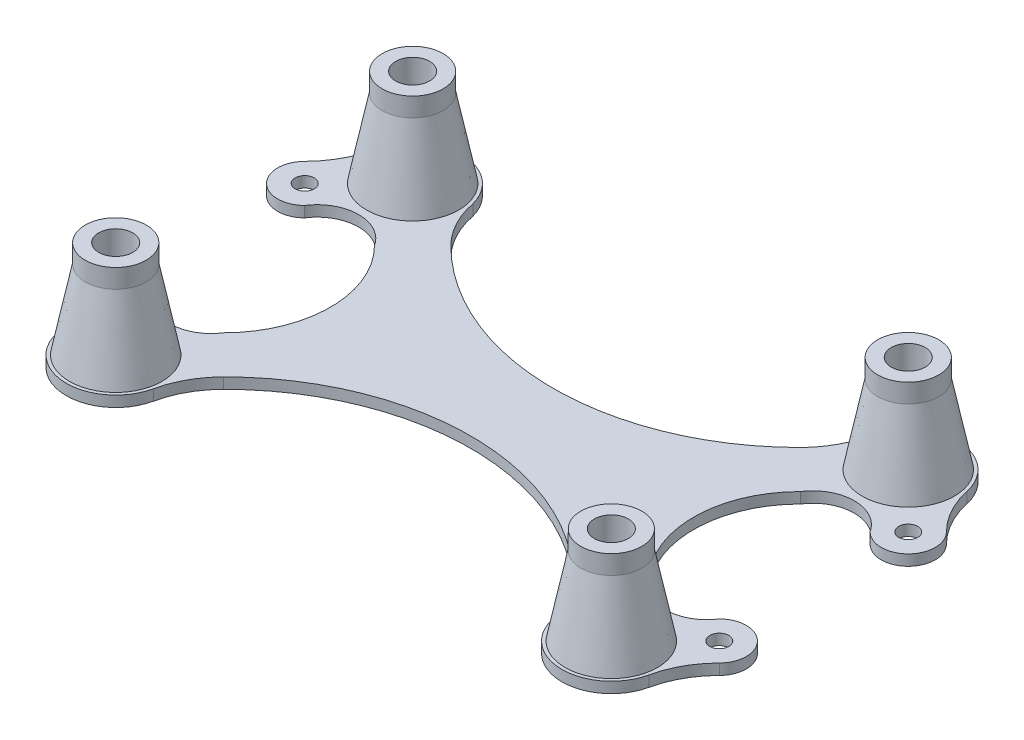
from build123d import *

# Parameters (mm, degrees)
BOSS_EXTRUDE1_DEPTH   = 2.54
SKETCH1_4_R           = 7.175
SKETCH1_4_R_2         = 4
BOSS_EXTRUDE2_DEPTH   = 25.4
F_8_CLEARANCE_HOLE2_D = 4.4958
LPATTERN1_COUNT       = 2
LPATTERN1_PITCH       = 116.586
LPATTERN1_COUNT_DIR2  = 2
LPATTERN1_PITCH_DIR2  = 69.85


with BuildPart() as part:
    # Sketch1 → Boss-Extrude1 (new body)
    with BuildSketch(Plane(origin=(0, 0, 0), x_dir=(1, 0, 0), z_dir=(0, 1, 0))):
        with BuildLine():
            ThreePointArc((8.209871939, -17.190128061), (15.555896424, -34.925), (8.209871939, -52.659871939))
            ThreePointArc((8.209871939, -52.659871939), (0, -57.15), (-8.209871939, -52.659871939))
            ThreePointArc((-8.209871939, -52.659871939), (-17.190128061, -52.659871939), (-17.190128061, -61.640128061))
            ThreePointArc((-17.190128061, -61.640128061), (-13.499098781, -66.567297756), (-11.341832503, -72.333310292))
            ThreePointArc((-11.341832503, -72.333310292), (0, -81.460512242), (11.341832503, -72.333310292))
            ThreePointArc((11.341832503, -72.333310292), (13.499098781, -66.567297756), (17.190128061, -61.640128061))
            ThreePointArc((17.190128061, -61.640128061), (58.293, -44.614761051), (99.395871939, -61.640128061))
            ThreePointArc((99.395871939, -61.640128061), (103.086901219, -66.567297756), (105.244167497, -72.333310292))
            ThreePointArc((105.244167497, -72.333310292), (116.586, -81.460512242), (127.927832503, -72.333310292))
            ThreePointArc((127.927832503, -72.333310292), (130.085098781, -66.567297756), (133.776128061, -61.640128061))
            ThreePointArc((133.776128061, -61.640128061), (133.776128061, -52.659871939), (124.795871939, -52.659871939))
            ThreePointArc((124.795871939, -52.659871939), (116.586, -57.15), (108.376128061, -52.659871939))
            ThreePointArc((108.376128061, -52.659871939), (101.030103576, -34.925), (108.376128061, -17.190128061))
            ThreePointArc((108.376128061, -17.190128061), (116.586, -12.7), (124.795871939, -17.190128061))
            ThreePointArc((124.795871939, -17.190128061), (133.776128061, -17.190128061), (133.776128061, -8.209871939))
            ThreePointArc((133.776128061, -8.209871939), (130.085098781, -3.282702244), (127.927832503, 2.483310292))
            ThreePointArc((127.927832503, 2.483310292), (116.825136798, 11.608049281), (105.356064016, 2.948310079))
            ThreePointArc((105.356064016, 2.948310079), (103.204339104, -3.073259016), (99.395871939, -8.209871939))
            ThreePointArc((99.395871939, -8.209871939), (58.293, -25.235238949), (17.190128061, -8.209871939))
            ThreePointArc((17.190128061, -8.209871939), (13.381660896, -3.073259016), (11.229935984, 2.948310079))
            ThreePointArc((11.229935984, 2.948310079), (-0.239136798, 11.608049281), (-11.341832503, 2.483310292))
            ThreePointArc((-11.341832503, 2.483310292), (-13.499098781, -3.282702244), (-17.190128061, -8.209871939))
            ThreePointArc((-17.190128061, -8.209871939), (-17.190128061, -17.190128061), (-8.209871939, -17.190128061))
            ThreePointArc((-8.209871939, -17.190128061), (0, -12.7), (8.209871939, -17.190128061))
        make_face()
    extrude(amount=BOSS_EXTRUDE1_DEPTH)

    # Sketch1<4> → Boss-Extrude2 (add)
    # profile 1 of 4: a face of its own
    with BuildSketch(Plane(origin=(0, 0, 0), x_dir=(1, 0, 0), z_dir=(0, 1, 0))):
        Circle(SKETCH1_4_R)
        Circle(SKETCH1_4_R_2, mode=Mode.SUBTRACT)
    # profile 2 of 4: a face of its own
    with BuildSketch(Plane(origin=(0, 0, 0), x_dir=(1, 0, 0), z_dir=(0, 1, 0))):
        with Locations((116.586, 0)):
            Circle(SKETCH1_4_R)
        with Locations((116.586, 0)):
            Circle(SKETCH1_4_R_2, mode=Mode.SUBTRACT)
    # profile 3 of 4: a face of its own
    with BuildSketch(Plane(origin=(0, 0, 0), x_dir=(1, 0, 0), z_dir=(0, 1, 0))):
        with Locations((0, -69.85)):
            Circle(SKETCH1_4_R)
        with Locations((0, -69.85)):
            Circle(SKETCH1_4_R_2, mode=Mode.SUBTRACT)
    # profile 4 of 4: a face of its own
    with BuildSketch(Plane(origin=(0, 0, 0), x_dir=(1, 0, 0), z_dir=(0, 1, 0))):
        with Locations((116.586, -69.85)):
            Circle(SKETCH1_4_R)
        with Locations((116.586, -69.85)):
            Circle(SKETCH1_4_R_2, mode=Mode.SUBTRACT)
    extrude(amount=BOSS_EXTRUDE2_DEPTH)

    # #8 Clearance Hole2 (through all)
    with Locations(Plane(origin=(0, 2.54, 0), x_dir=(1, 0, 0), z_dir=(0, 1, 0))):
        with Locations((129.286, -12.7), (129.286, -57.15), (-12.7, -57.15), (-12.7, -12.7)):
            Hole(F_8_CLEARANCE_HOLE2_D / 2)

    # Sketch8 → Revolve1 (revolve)
    with BuildSketch(Plane(origin=(0, 0, 0), x_dir=(0, 0, -1), z_dir=(1, 0, 0))):
        Polygon((10.856911267, 2.54), (7.046911267, 21.59), (7.046911267, 2.54), align=None)
    revolve1 = revolve(axis=Axis((0, 0, 0), (0, 1, 0)))

    # LPattern1: Revolve1 2 × 2
    with Locations(*[(i * LPATTERN1_PITCH, 0, j * LPATTERN1_PITCH_DIR2) for i in range(LPATTERN1_COUNT) for j in range(LPATTERN1_COUNT_DIR2) if (i, j) != (0, 0)]):
        add(revolve1)


solid = part.part
